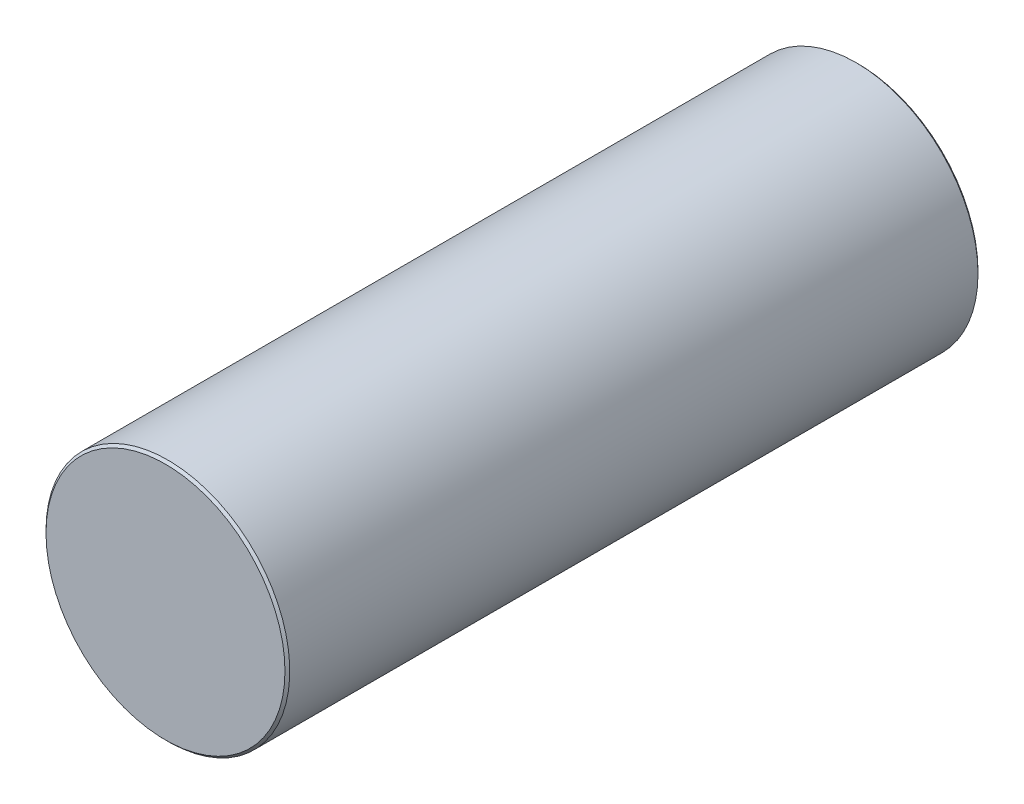
from build123d import *

# Parameters (mm, degrees)
SKETCH2_R           = 2.55
BOSS_EXTRUDE1_DEPTH = 14.5
CHAMFER2_SIZE       = 0.05


with BuildPart() as part:
    # Sketch2 → Boss-Extrude1 (new body)
    with BuildSketch(Plane.XY):
        Circle(SKETCH2_R)
    extrude(amount=BOSS_EXTRUDE1_DEPTH)

    # Chamfer2
    chamfer2_edges = [part.edges().sort_by_distance(p)[0] for p in [
        (-2.55, 0, 14.5),
        (-2.55, 0, 0),
    ]]
    chamfer(chamfer2_edges, length=CHAMFER2_SIZE)


solid = part.part
